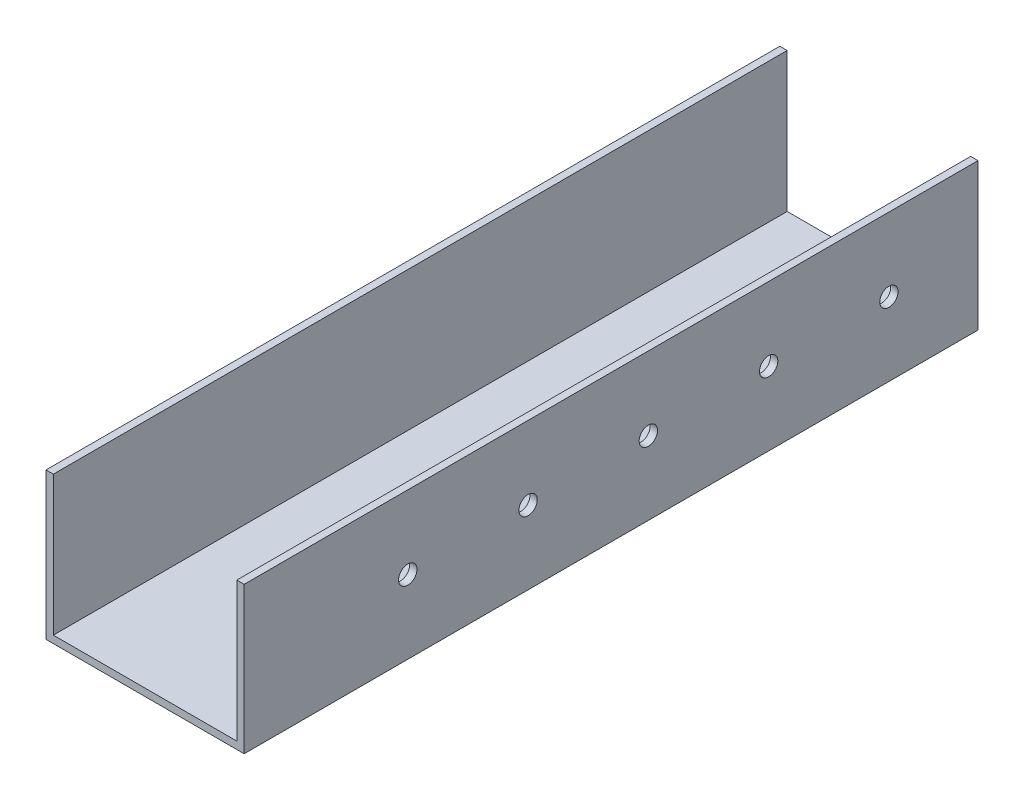
from build123d import *

# Parameters (mm, degrees)
SALIENTE_EXTRUIR1_DEPTH = 100
CROQUIS2_R              = 2.5
CORTAR_EXTRUIR1_DEPTH   = 10


with BuildPart() as part:
    # Croquis1 → Saliente-Extruir1 (new, symmetric)
    with BuildSketch(Plane.XY):
        Polygon((-25, 20), (-27, 20), (-27, -20), (27, -20), (27, 20), (25, 20), (25, -18), (-25, -18), align=None)
    extrude(amount=SALIENTE_EXTRUIR1_DEPTH, both=True)

    # Croquis2 → Cortar-Extruir1 (cut)
    with BuildSketch(Plane(origin=(27, 0, 0), x_dir=(0, 0, -1), z_dir=(1, 0, 0))):
        with Locations((-55.4, 0)):
            Circle(CROQUIS2_R)
        with Locations((-22.62, 0)):
            Circle(CROQUIS2_R)
        with Locations((10.16, 0)):
            Circle(CROQUIS2_R)
        with Locations((42.94, 0)):
            Circle(CROQUIS2_R)
        with Locations((75.72, 0)):
            Circle(CROQUIS2_R)
    extrude(amount=-CORTAR_EXTRUIR1_DEPTH, mode=Mode.SUBTRACT)


solid = part.part
